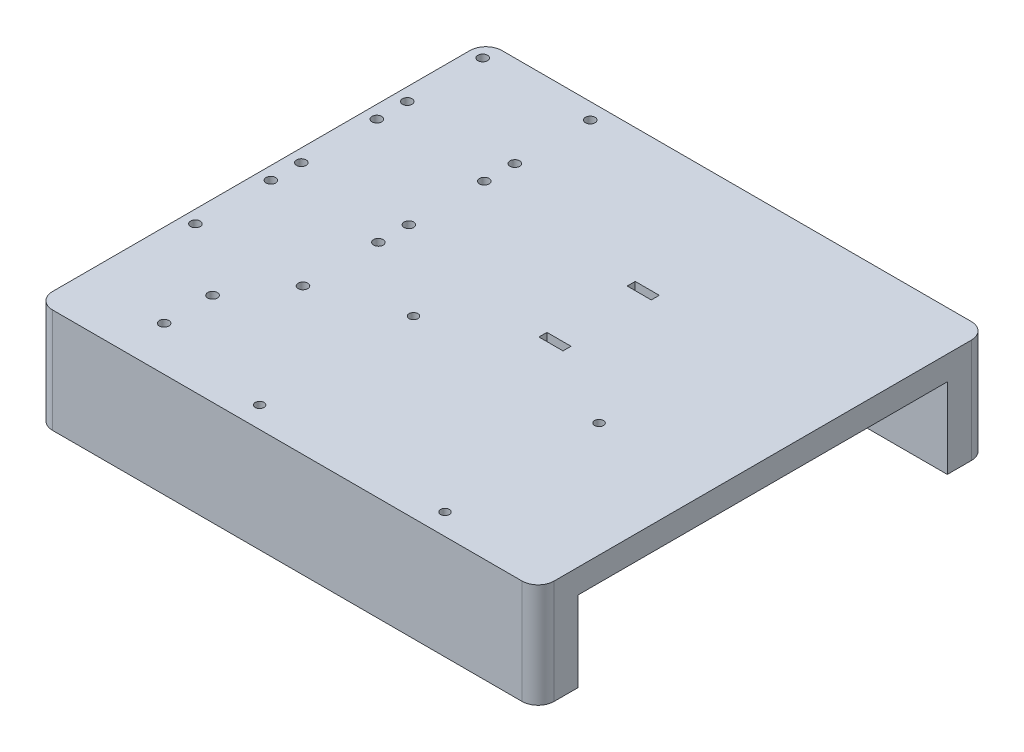
from build123d import *

# Parameters (mm, degrees)
BOSS_EXTRUDE1_DEPTH = 7.62
SKETCH5_W           = 158.75
SKETCH5_H           = 12.7
BOSS_EXTRUDE2_DEPTH = 25.4
FILLET1_R           = 5.08
SKETCH3_R           = 1.397
SKETCH3_R_2         = 1.524
CUT_EXTRUDE1_DEPTH  = 7.62
SKETCH6_W           = 7.62
SKETCH6_H           = 2.54
CUT_EXTRUDE3_DEPTH  = 7.62


with BuildPart() as part:
    # Sketch1 → Boss-Extrude1 (new body)
    with BuildSketch(Plane(origin=(0, 0, 0), x_dir=(1, 0, 0), z_dir=(0, 1, 0))):
        Polygon((0, 0), (120.65, 0), (120.65, 142.24), (-38.1, 142.24), (-38.1, 0), align=None)
    extrude(amount=BOSS_EXTRUDE1_DEPTH)

    # Sketch5 → Boss-Extrude2 (add)
    with BuildSketch(Plane(origin=(0, 0, 0), x_dir=(-1, 0, 0), z_dir=(0, -1, 0))):
        with Locations((-41.275, 6.35)):
            Rectangle(SKETCH5_W, SKETCH5_H)
        with Locations((-41.275, 135.89)):
            Rectangle(SKETCH5_W, SKETCH5_H)
    extrude(amount=BOSS_EXTRUDE2_DEPTH)

    # Fillet1
    fillet1_edges = [part.edges().sort_by_distance(p)[0] for p in [
        (-38.1, -8.89, 0),
        (120.65, -8.89, 0),
        (120.65, -8.89, -142.24),
        (-38.1, -8.89, -142.24),
    ]]
    fillet(fillet1_edges, radius=FILLET1_R)

    # Sketch3 → Cut-Extrude1 (cut)
    with BuildSketch(Plane(origin=(0, 7.62, 0), x_dir=(1, 0, 0), z_dir=(0, 1, 0))):
        with Locations((25.781, 6.731)):
            Circle(SKETCH3_R)
        with Locations((25.781, 55.4355)):
            Circle(SKETCH3_R)
        with Locations((84.455, 55.499)):
            Circle(SKETCH3_R)
        with Locations((84.455, 6.731)):
            Circle(SKETCH3_R)
        with Locations((-34.036, 137.16)):
            Circle(SKETCH3_R_2)
        with Locations((0, 137.16)):
            Circle(SKETCH3_R_2)
        with Locations((-34.036, 113.284)):
            Circle(SKETCH3_R_2)
        with Locations((0, 113.284)):
            Circle(SKETCH3_R_2)
        with Locations((-34.036, 103.632)):
            Circle(SKETCH3_R_2)
        with Locations((0, 103.632)):
            Circle(SKETCH3_R_2)
        with Locations((-34.036, 79.756)):
            Circle(SKETCH3_R_2)
        with Locations((0, 79.756)):
            Circle(SKETCH3_R_2)
        with Locations((-34.036, 70.104)):
            Circle(SKETCH3_R_2)
        with Locations((0, 70.104)):
            Circle(SKETCH3_R_2)
        with Locations((-34.036, 46.228)):
            Circle(SKETCH3_R_2)
        with Locations((0, 46.228)):
            Circle(SKETCH3_R_2)
        with Locations((-11.7348, 14.003291804)):
            Circle(SKETCH3_R_2)
        with Locations((-11.7348, 29.334943362)):
            Circle(SKETCH3_R_2)
    extrude(amount=-CUT_EXTRUDE1_DEPTH, mode=Mode.SUBTRACT)

    # Sketch6 → Cut-Extrude3 (cut)
    with BuildSketch(Plane(origin=(0, 7.62, 0), x_dir=(1, 0, 0), z_dir=(0, 1, 0))):
        with Locations((55.167188758, 70.832515898)):
            Rectangle(SKETCH6_W, SKETCH6_H)
        with Locations((55.167188758, 98.772515898)):
            Rectangle(SKETCH6_W, SKETCH6_H)
    extrude(amount=-CUT_EXTRUDE3_DEPTH, mode=Mode.SUBTRACT)


solid = part.part
